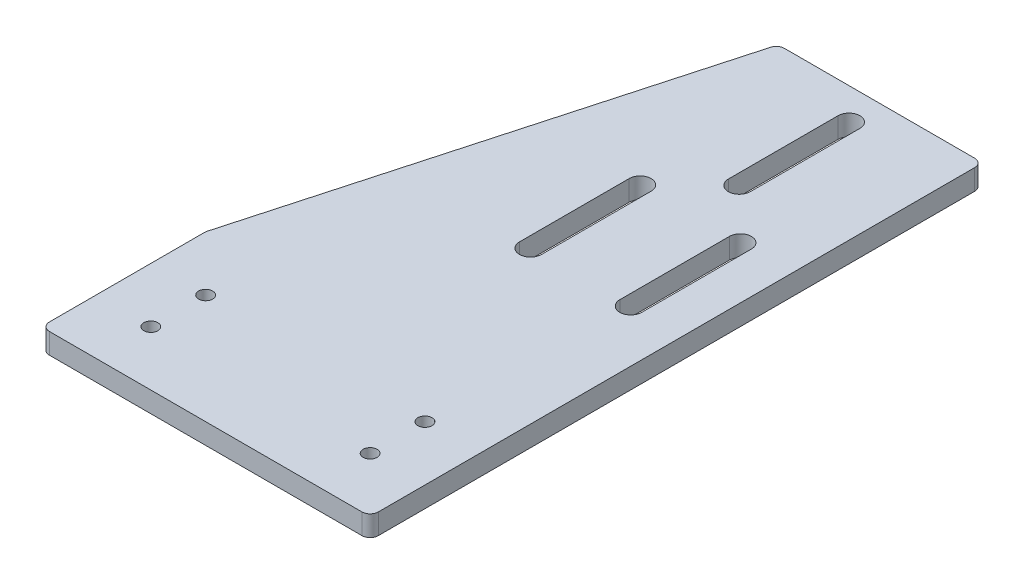
from build123d import *

# Parameters (mm, degrees)
SKETCH4_R           = 3.2512
BOSS_EXTRUDE1_DEPTH = 9.525


with BuildPart() as part:
    # Sketch4 → Boss-Extrude1 (new body)
    with BuildSketch(Plane(origin=(0, 0, 0), x_dir=(1, 0, 0), z_dir=(0, 1, 0))):
        with BuildLine():
            Line((-48.168189159, 52.45363032), (-104.867602971, -151.900126859))
            ThreePointArc((-104.867602971, -151.900126859), (-104.971463782, -152.40474269), (-105.006296354, -152.918757179))
            Line((-105.006296354, -152.918757179), (-105.006296354, -224.79))
            ThreePointArc((-105.006296354, -224.79), (-103.890373191, -227.484076836), (-101.196296354, -228.6))
            Line((-101.196296354, -228.6), (43.583703646, -228.6))
            ThreePointArc((43.583703646, -228.6), (46.277780482, -227.484076836), (47.393703646, -224.79))
            Line((47.393703646, -224.79), (47.393703646, 51.435))
            ThreePointArc((47.393703646, 51.435), (46.277780482, 54.129076836), (43.583703646, 55.245))
            Line((43.583703646, 55.245), (-44.496882543, 55.245))
            ThreePointArc((-44.496882543, 55.245), (-46.802865899, 54.467909619), (-48.168189159, 52.45363032))
        make_face()
        with Locations((21.993703646, -203.2)):
            Circle(SKETCH4_R, mode=Mode.SUBTRACT)
        with Locations((21.993703646, -177.8)):
            Circle(SKETCH4_R, mode=Mode.SUBTRACT)
        with Locations((-79.606296354, -203.2)):
            Circle(SKETCH4_R, mode=Mode.SUBTRACT)
        with Locations((-79.606296354, -177.8)):
            Circle(SKETCH4_R, mode=Mode.SUBTRACT)
        with BuildLine():
            Line((18.183703646, -83.742865934), (18.183703646, -32.942865934))
            ThreePointArc((18.183703646, -32.942865934), (23.263703646, -27.862865934), (28.343703646, -32.942865934))
            Line((28.343703646, -32.942865934), (28.343703646, -83.742865934))
            ThreePointArc((28.343703646, -83.742865934), (23.263703646, -88.822865934), (18.183703646, -83.742865934))
        make_face(mode=Mode.SUBTRACT)
        with BuildLine():
            Line((-5.08, -10.16), (-5.08, 40.64))
            ThreePointArc((-5.08, 40.64), (0, 45.72), (5.08, 40.64))
            Line((5.08, 40.64), (5.08, -10.16))
            ThreePointArc((5.08, -10.16), (0, -15.24), (-5.08, -10.16))
        make_face(mode=Mode.SUBTRACT)
        with BuildLine():
            Line((-28.247895275, -83.742865934), (-28.247895275, -32.942865934))
            ThreePointArc((-28.247895275, -32.942865934), (-23.167895275, -27.862865934), (-18.087895275, -32.942865934))
            Line((-18.087895275, -32.942865934), (-18.087895275, -83.742865934))
            ThreePointArc((-18.087895275, -83.742865934), (-23.167895275, -88.822865934), (-28.247895275, -83.742865934))
        make_face(mode=Mode.SUBTRACT)
    extrude(amount=BOSS_EXTRUDE1_DEPTH)


solid = part.part
